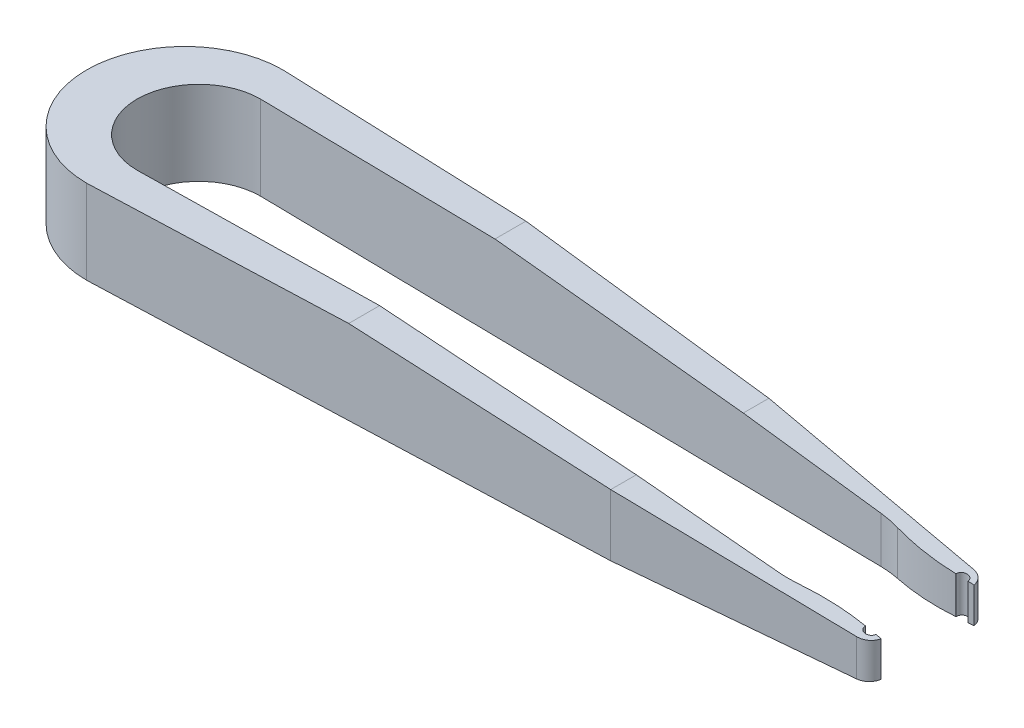
from build123d import *

# Parameters (mm, degrees)
SKETCH1_W                = 76.2
SKETCH1_H                = 17.78
BOSS_EXTRUDE1_DEPTH      = 7.62
FILLET1_R                = 8.89
CUT_EXTRUDE8_DEPTH       = 40.858581259
CUT_EXTRUDE9_DEPTH       = 40.858581259
CUT_EXTRUDE10_DEPTH      = 40.858581259
FILLET5_R                = 8.89
FILLET6_R                = 1.27
CUT_EXTRUDE11_DEPTH      = 40.858581259
SKETCH11_R               = 0.508
CUT_EXTRUDE12_DEPTH      = 40.858581259
CUT_EXTRUDE14_DEPTH      = 40.858581259
CUT_EXTRUDE14_DEPTH_BACK = 40.858581259
FILLET7_R                = 20.32


# Some blends are built 0.0001 mm under size
with BuildPart() as part:
    # Sketch1 → Boss-Extrude1 (new body)
    with BuildSketch(Plane(origin=(0, 0, 0), x_dir=(1, 0, 0), z_dir=(0, 1, 0))):
        Rectangle(SKETCH1_W, SKETCH1_H)
    extrude(amount=BOSS_EXTRUDE1_DEPTH)

    # Fillet1
    fillet1_edges = [part.edges().sort_by_distance(p)[0] for p in [
        (-38.1, 3.81, -8.89),
        (-38.1, 3.81, 8.89),
    ]]
    fillet(fillet1_edges, radius=FILLET1_R - 0.0001)  # a hair under: the kernel refuses the full size

    # Sketch2 → Cut-Extrude8 (cut, through all)
    with BuildSketch(Plane(origin=(0, 7.62, 0), x_dir=(1, 0, 0), z_dir=(0, 1, 0))):
        with BuildLine():
            Line((38.1, -3.81), (38.1, 3.81))
            Line((38.1, 3.81), (32.835440572, 3.81))
            Line((32.835440572, 3.81), (32.835440572, 4.572))
            Line((32.835440572, 4.572), (-27.94, 5.588))
            ThreePointArc((-27.94, 5.588), (-33.528, 0), (-27.94, -5.588))
            Line((-27.94, -5.588), (32.835440572, -4.572))
            Line((32.835440572, -4.572), (32.835440572, -3.81))
            Line((32.835440572, -3.81), (38.1, -3.81))
        make_face()
    extrude(amount=-CUT_EXTRUDE8_DEPTH, mode=Mode.SUBTRACT)

    # Sketch8 → Cut-Extrude9 (cut, through all)
    with BuildSketch(Plane(origin=(0, 7.62, 0), x_dir=(1, 0, 0), z_dir=(0, 1, 0))):
        Polygon((-29.21, 8.89), (38.1, 6.35), (38.1, 8.89), align=None)
    cut_extrude9 = extrude(amount=-CUT_EXTRUDE9_DEPTH, mode=Mode.SUBTRACT)

    # Mirror5: Cut-Extrude9 across plane
    add(cut_extrude9.mirror(Plane.XY), mode=Mode.SUBTRACT)

    # Sketch9 → Cut-Extrude10 (cut, through all)
    with BuildSketch(Plane(origin=(0, 7.62, 0), x_dir=(1, 0, 0), z_dir=(0, 1, 0))):
        Polygon((16.543360441, 7.163458097), (38.1, 5.185109732), (38.1, 6.35), align=None)
    cut_extrude10 = extrude(amount=-CUT_EXTRUDE10_DEPTH, mode=Mode.SUBTRACT)

    # Mirror6: Cut-Extrude10 across plane
    add(cut_extrude10.mirror(Plane.XY), mode=Mode.SUBTRACT)

    # Fillet5
    # the kernel refuses this fillet: 8.89 mm, written as the material it adds along each edge
    with BuildSketch(Plane(origin=(32.835440572, 7.62, 4.572), x_dir=(-0.999860295571869, 0, 0.01671494358156383), z_dir=(0, -1, 0))) as fillet5_piece_1:
        with BuildLine():
            CenterArc((3.588094431, 8.89), FILLET5_R, 246.106185647, 23.893814353)
            Line((-0.012736787, 0.761893545), (-0.084753411, 0.599331416))
            ThreePointArc((-0.084753411, 0.599331416), (-0.184143554, 0.377974856), (-0.177775161, -0.002971917))
            Line((-0.177775161, -0.002971917), (0, -0.1778))
            Line((0, -0.1778), (3.588094431, -0.1778))
            Line((3.588094431, -0.1778), (3.588094431, 0))
        make_face()
    extrude(amount=7.62)
    with BuildSketch(Plane(origin=(32.835440572, 7.62, -4.572), x_dir=(0, 0, 1), z_dir=(0, -1, 0))) as fillet5_piece_2:
        with BuildLine():
            CenterArc((8.828783232, 3.736189007), FILLET5_R, 180.957740323, 23.893814353)
            Line((-0.059974796, 3.587593158), (-0.237749957, 3.584621241))
            Line((-0.237749957, 3.584621241), (-0.177775161, -0.002971917))
            Line((-0.177775161, -0.002971917), (0, -0.1778))
            ThreePointArc((0, -0.1778), (0.381, -0.1778), (0.600664335, -0.07472378))
            Line((0.600664335, -0.07472378), (0.762, 0))
        make_face()
    extrude(amount=7.62)

    # Fillet6
    fillet6_edges = [part.edges().sort_by_distance(p)[0] for p in [
        (38.1, 3.81, -5.185109732),
        (38.1, 3.81, 5.185109732),
    ]]
    fillet(fillet6_edges, radius=FILLET6_R)

    # Sketch10 → Cut-Extrude11 (cut, through all)
    with BuildSketch(Plane(origin=(0, 7.62, 0), x_dir=(1, 0, 0), z_dir=(0, 1, 0))):
        Polygon((32.835440572, 3.81), (38.086687384, 4.209729588), (38.737760676, 3.81), align=None)
    cut_extrude11 = extrude(amount=-CUT_EXTRUDE11_DEPTH, mode=Mode.SUBTRACT)

    # Mirror7: Cut-Extrude11 across plane
    add(cut_extrude11.mirror(Plane.XY), mode=Mode.SUBTRACT)

    # Sketch11 → Cut-Extrude12 (cut, through all)
    with BuildSketch(Plane(origin=(0, 7.62, 0), x_dir=(1, 0, 0), z_dir=(0, 1, 0))):
        with Locations((37.070687384, 4.132390762)):
            Circle(SKETCH11_R)
    cut_extrude12 = extrude(amount=-CUT_EXTRUDE12_DEPTH, mode=Mode.SUBTRACT)

    # Mirror8: Cut-Extrude12 across plane
    add(cut_extrude12.mirror(Plane.XY), mode=Mode.SUBTRACT)

    # Sketch13 → Cut-Extrude14 (cut, two sides: drawn at the far end of the back side and taken through both)
    with BuildSketch(Plane.XY.offset(-CUT_EXTRUDE14_DEPTH_BACK)):
        Polygon((-6.333319779, 7.62), (16.543360441, 5.594868468), (38.086687384, 3.194451795), (38.086687384, 7.62), align=None)
    extrude(amount=CUT_EXTRUDE14_DEPTH + CUT_EXTRUDE14_DEPTH_BACK, mode=Mode.SUBTRACT)

    # Fillet7
    fillet7_edges = [part.edges().sort_by_distance(p)[0] for p in [
        (32.835440572, 1.889780071, -3.81),
        (32.835440572, 1.889780071, 3.81),
    ]]
    fillet(fillet7_edges, radius=FILLET7_R)


solid = part.part
